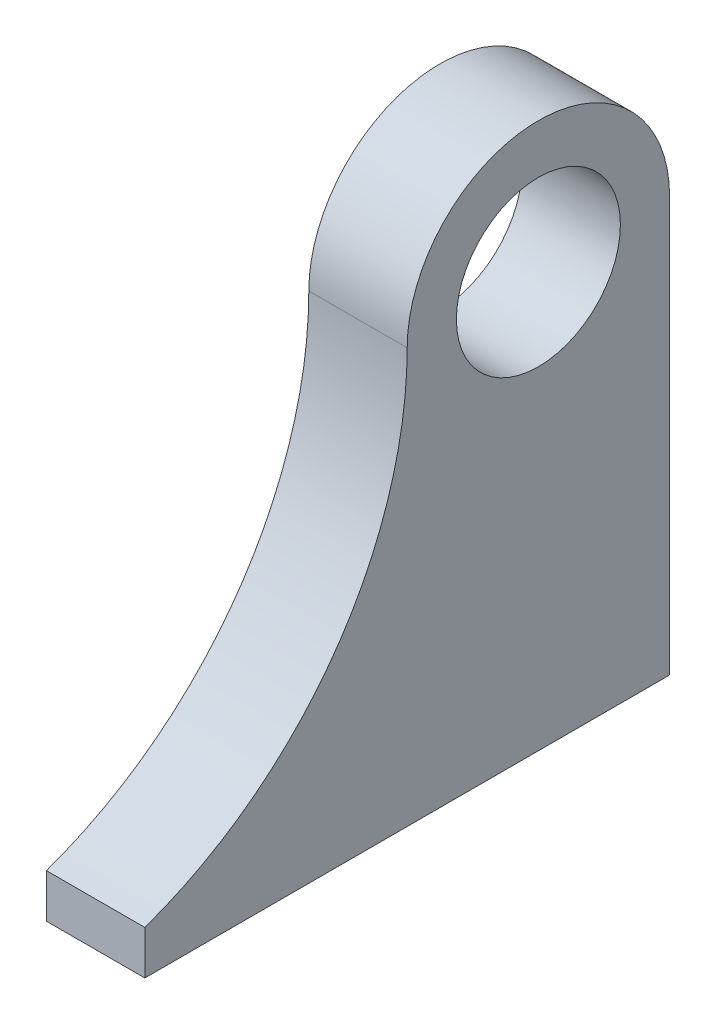
from build123d import *

# Parameters (mm, degrees)
CROQUIS1_W              = 4.7625
CROQUIS1_H              = 42.333333333
SALIENTE_EXTRUIR1_DEPTH = 26.416
CROQUIS2_R              = 3.96875
CORTAR_EXTRUIR1_DEPTH   = 25.4


with BuildPart() as part:
    # Croquis1 → Saliente-Extruir1 (new body)
    with BuildSketch(Plane(origin=(0, 0, 0), x_dir=(1, 0, 0), z_dir=(0, 1, 0))):
        with Locations((604.572916667, 432.985333334)):
            Rectangle(CROQUIS1_W, CROQUIS1_H)
    extrude(amount=SALIENTE_EXTRUIR1_DEPTH)

    # Croquis2 → Cortar-Extruir1 (cut)
    with BuildSketch(Plane(origin=(606.954166667, 0, 0), x_dir=(0, 0, -1), z_dir=(1, 0, 0))):
        with BuildLine():
            ThreePointArc((432.985333333, 26.416), (437.475461394, 24.556128061), (439.335333333, 20.066))
            Line((439.335333333, 20.066), (439.335333333, 0))
            Line((439.335333333, 0), (454.152, 0))
            Line((454.152, 0), (454.152, 26.416))
            Line((454.152, 26.416), (432.985333333, 26.416))
        make_face()
        with BuildLine():
            ThreePointArc((426.635333333, 20.066), (428.495205273, 24.556128061), (432.985333333, 26.416))
            Line((432.985333333, 26.416), (411.818666667, 26.416))
            Line((411.818666667, 26.416), (411.818666667, 0))
            Line((411.818666667, 0), (413.935333333, 0))
            Line((413.935333333, 0), (413.935333333, 2.12))
            ThreePointArc((413.935333333, 2.12), (423.139169599, 9.073401172), (426.635333333, 20.066))
        make_face()
        with Locations((432.985333333, 20.066)):
            Circle(CROQUIS2_R)
    extrude(amount=-CORTAR_EXTRUIR1_DEPTH, mode=Mode.SUBTRACT)


solid = part.part
